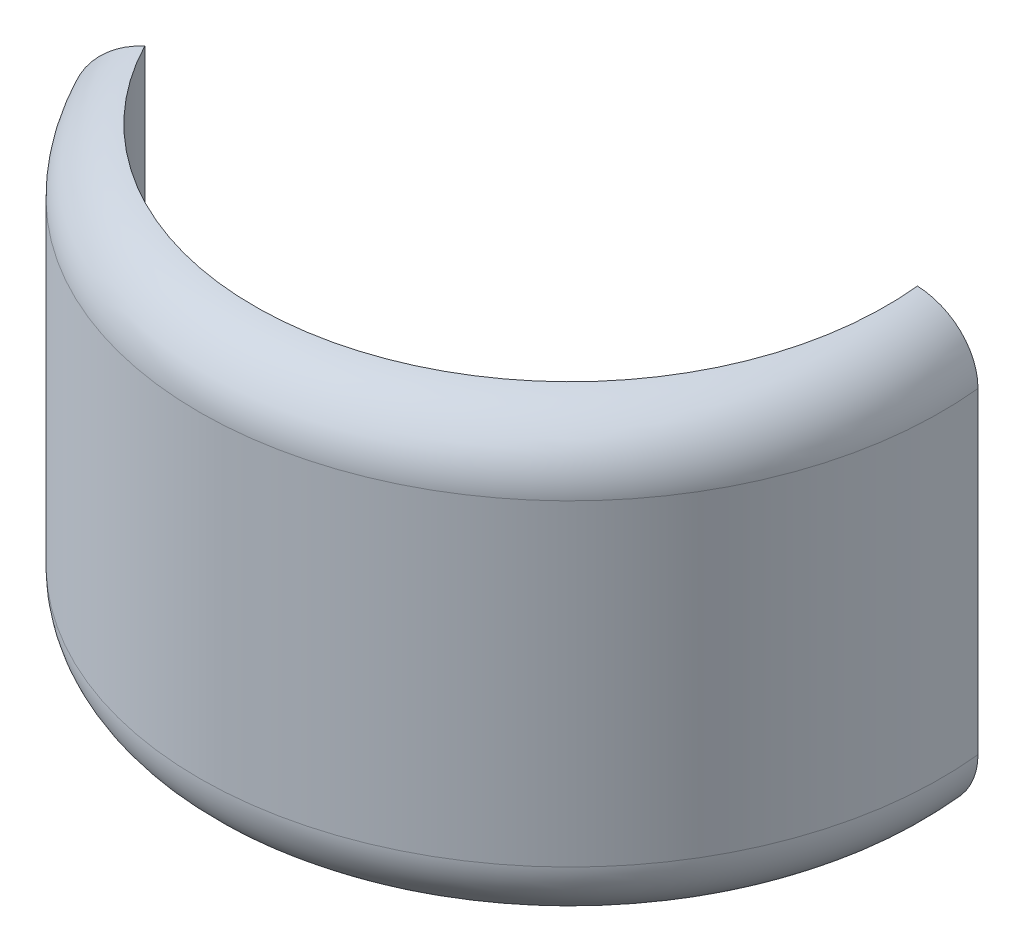
from build123d import *

# Parameters (mm, degrees)
BOSS_EXTRUDE1_DEPTH = 24
FILLET1_R           = 3.5


with BuildPart() as part:
    # Sketch2 → Boss-Extrude1 (new body)
    with BuildSketch(Plane(origin=(0, 0, 0), x_dir=(1, 0, 0), z_dir=(0, 1, 0))):
        with BuildLine():
            ThreePointArc((11.591585182, 1.269721351), (-3.263225558, -10.020142683), (-19.529660289, -0.880693402))
            Line((-19.529660289, -0.880693402), (-19.773089177, -1.006807758))
            Line((-19.773089177, -1.006807758), (-22.163972243, -2.245463863))
            ThreePointArc((-22.163972243, -2.245463863), (0.291704356, -12.459871192), (15.531753085, 6.939418571))
            ThreePointArc((15.531753085, 6.939418571), (15.503757233, 7.996392633), (15.419848185, 9.050402694))
            Line((15.419848185, 9.050402694), (12.469626172, 8.736734142))
            ThreePointArc((12.469626172, 8.736734142), (12.517251304, 5.667453249), (12.012150504, 2.639644382))
            ThreePointArc((12.012150504, 2.639644382), (11.918925763, 2.297657269), (11.818590923, 1.957688215))
            ThreePointArc((11.818590923, 1.957688215), (11.708753165, 1.61249542), (11.591585182, 1.269721351))
        make_face()
    extrude(amount=BOSS_EXTRUDE1_DEPTH)

    # Fillet1
    # the kernel refuses this fillet: 3.5 mm, written as the material it takes off along each edge
    with BuildSketch(Plane(origin=(-4.43509674, 0, -6.939418571), x_dir=(-0.9990167342617219, 0, 0.04433468918402287), z_dir=(-0.04433468918402287, 0, -0.9990167342617219))) as fillet1_piece_1:
        with BuildLine():
            CenterArc((16.466849825, 3.45915465), FILLET1_R, 278.761897774, 81.238102226)
            Line((17, 0), (17.010663004, -0.069183093))
            ThreePointArc((17.010663004, -0.069183093), (18.483424912, -0.07), (19.966849825, -0.07))
            Line((19.966849825, -0.07), (20.036849825, 0))
            Line((20.036849825, 0), (20.036849825, 3.45915465))
            Line((20.036849825, 3.45915465), (19.966849825, 3.45915465))
        make_face()
    revolve(axis=Axis((-4.43509674, 0, -6.939418571), (0, 1, 0)), revolution_arc=208.374392147, mode=Mode.SUBTRACT)
    with BuildSketch(Plane(origin=(-4.43509674, 24, -6.939418571), x_dir=(0.85792670476254, 0, -0.5137720985566359), z_dir=(-0.5137720985566359, 0, -0.85792670476254))) as fillet1_piece_2:
        with BuildLine():
            CenterArc((16.466849825, 3.45915465), FILLET1_R, 278.761897774, 81.238102226)
            Line((19.966849825, 3.45915465), (20.036849825, 3.45915465))
            Line((20.036849825, 3.45915465), (20.036849825, 0))
            Line((20.036849825, 0), (19.966849825, -0.07))
            ThreePointArc((19.966849825, -0.07), (18.483424912, -0.07), (17.010663004, -0.069183093))
            Line((17.010663004, -0.069183093), (17, 0))
        make_face()
    revolve(axis=Axis((-4.43509674, 24, -6.939418571), (0, -1, 0)), revolution_arc=208.374392147, mode=Mode.SUBTRACT)


solid = part.part
